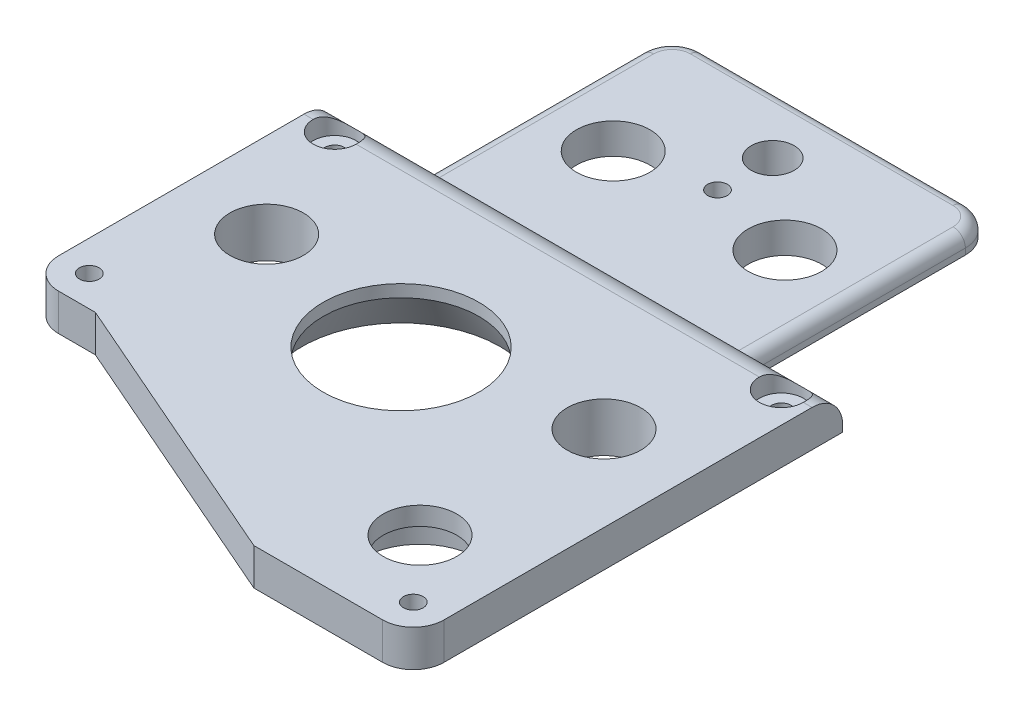
from build123d import *
from OCP.BRepFilletAPI import BRepFilletAPI_MakeChamfer

# Parameters (mm, degrees)
BOSS_EXTRUDE1_DEPTH = 3
BOSS_EXTRUDE2_DEPTH = 2
CHAMFER1_SIZE       = 2
CHAMFER1_SIZE_2     = 0.352653961
SKETCH3_R           = 6
SKETCH3_R_2         = 3.5
SKETCH3_R_3         = 1.6
CUT_EXTRUDE1_DEPTH  = 70.029171396
BOSS_EXTRUDE3_DEPTH = 3
FILLET1_R           = 5
CUT_EXTRUDE3_REACH  = 71.311
SKETCH6_R           = 12.7
SKETCH6_R_2         = 6
SKETCH7_R           = 9.5
CUT_EXTRUDE4_DEPTH  = 5
CHAMFER2_SIZE       = 6
CHAMFER2_SIZE2      = 3.464101615
FILLET2_R           = 5
FILLET3_R           = 2
SKETCH9_R           = 1.6
CUT_EXTRUDE5_DEPTH  = 70.311085058
SKETCH10_R          = 3.5
SKETCH10_R_2        = 3.584283701
CUT_EXTRUDE6_DEPTH  = 3
SKETCH11_W          = 5.4
SKETCH11_H          = 5.4
CUT_EXTRUDE7_DEPTH  = 2


# Some blends are built 0.0001 mm under size
with BuildPart() as part:
    # Sketch1 → Boss-Extrude1 (new body)
    with BuildSketch(Plane(origin=(0, 0, 0), x_dir=(1, 0, 0), z_dir=(0, 1, 0))):
        Polygon((-26.412878475, 15), (-26.412878475, 55), (26.412878475, 55), (26.412878475, 15), (41.412878475, 15), (41.412878475, -55), (15.412878475, -55), (-30.412878475, -35), (-41.412878475, -35), (-41.412878475, 15), align=None)
    extrude(amount=BOSS_EXTRUDE1_DEPTH)

    # Sketch2 → Boss-Extrude2 (add)
    with BuildSketch(Plane.XZ):
        Polygon((-38.162878475, 31.75), (-38.162878475, -11.75), (-23.162878475, -11.75), (-23.162878475, -51.75), (23.162878475, -51.75), (23.162878475, -11.75), (38.162878475, -11.75), (38.162878475, 51.75), (16.09119297, 51.75), (-29.734563979, 31.75), align=None)
    extrude(amount=BOSS_EXTRUDE2_DEPTH)

    # Chamfer1
    chamfer1_edges_1 = [part.edges().sort_by_distance(p)[0] for p in [
        (-33.948721227, -2, 31.75),
    ]]
    chamfer1_side_1 = [part.faces().sort_by_distance(p)[0] for p in [
        (-33.948721227, -1.992946921, 31.75),
    ]]
    chamfer1_edges_2 = [part.edges().sort_by_distance(p)[0] for p in [
        (-6.821685504, -2, 41.75),
    ]]
    chamfer1_side_2 = [part.faces().sort_by_distance(p)[0] for p in [
        (-6.821685504, -1.992946921, 41.75),
    ]]
    chamfer1_edges_3 = [part.edges().sort_by_distance(p)[0] for p in [
        (27.127035723, -2, 51.75),
    ]]
    chamfer1_side_3 = [part.faces().sort_by_distance(p)[0] for p in [
        (27.127035723, -1.992946921, 51.75),
    ]]
    chamfer1_edges_4 = [part.edges().sort_by_distance(p)[0] for p in [
        (38.162878475, -2, 20),
    ]]
    chamfer1_side_4 = [part.faces().sort_by_distance(p)[0] for p in [
        (38.162878475, -1.992946921, 20),
    ]]
    chamfer1_edges_5 = [part.edges().sort_by_distance(p)[0] for p in [
        (30.662878475, -2, -11.75),
    ]]
    chamfer1_side_5 = [part.faces().sort_by_distance(p)[0] for p in [
        (30.662878475, -1.992946921, -11.75),
    ]]
    chamfer1_edges_6 = [part.edges().sort_by_distance(p)[0] for p in [
        (23.162878475, -2, -31.75),
    ]]
    chamfer1_side_6 = [part.faces().sort_by_distance(p)[0] for p in [
        (23.162878475, -1.992946921, -31.75),
    ]]
    chamfer1_edges_7 = [part.edges().sort_by_distance(p)[0] for p in [
        (0, -2, -51.75),
    ]]
    chamfer1_side_7 = [part.faces().sort_by_distance(p)[0] for p in [
        (0, -1.992946921, -51.75),
    ]]
    chamfer1_edges_8 = [part.edges().sort_by_distance(p)[0] for p in [
        (-23.162878475, -2, -31.75),
    ]]
    chamfer1_side_8 = [part.faces().sort_by_distance(p)[0] for p in [
        (-23.162878475, -1.992946921, -31.75),
    ]]
    chamfer1_edges_9 = [part.edges().sort_by_distance(p)[0] for p in [
        (-30.662878475, -2, -11.75),
    ]]
    chamfer1_side_9 = [part.faces().sort_by_distance(p)[0] for p in [
        (-30.662878475, -1.992946921, -11.75),
    ]]
    chamfer1_edges_10 = [part.edges().sort_by_distance(p)[0] for p in [
        (-38.162878475, -2, 10),
    ]]
    chamfer1_side_10 = [part.faces().sort_by_distance(p)[0] for p in [
        (-38.162878475, -1.992946921, 10),
    ]]
    chamfer1 = BRepFilletAPI_MakeChamfer(part.part.solid().wrapped)
    for e in chamfer1_edges_1:
        chamfer1.Add(CHAMFER1_SIZE - 0.0001, CHAMFER1_SIZE_2 - 0.0001, e.wrapped, chamfer1_side_1[0].wrapped)
    for e in chamfer1_edges_2:
        chamfer1.Add(CHAMFER1_SIZE - 0.0001, CHAMFER1_SIZE_2 - 0.0001, e.wrapped, chamfer1_side_2[0].wrapped)
    for e in chamfer1_edges_3:
        chamfer1.Add(CHAMFER1_SIZE - 0.0001, CHAMFER1_SIZE_2 - 0.0001, e.wrapped, chamfer1_side_3[0].wrapped)
    for e in chamfer1_edges_4:
        chamfer1.Add(CHAMFER1_SIZE - 0.0001, CHAMFER1_SIZE_2 - 0.0001, e.wrapped, chamfer1_side_4[0].wrapped)
    for e in chamfer1_edges_5:
        chamfer1.Add(CHAMFER1_SIZE - 0.0001, CHAMFER1_SIZE_2 - 0.0001, e.wrapped, chamfer1_side_5[0].wrapped)
    for e in chamfer1_edges_6:
        chamfer1.Add(CHAMFER1_SIZE - 0.0001, CHAMFER1_SIZE_2 - 0.0001, e.wrapped, chamfer1_side_6[0].wrapped)
    for e in chamfer1_edges_7:
        chamfer1.Add(CHAMFER1_SIZE - 0.0001, CHAMFER1_SIZE_2 - 0.0001, e.wrapped, chamfer1_side_7[0].wrapped)
    for e in chamfer1_edges_8:
        chamfer1.Add(CHAMFER1_SIZE - 0.0001, CHAMFER1_SIZE_2 - 0.0001, e.wrapped, chamfer1_side_8[0].wrapped)
    for e in chamfer1_edges_9:
        chamfer1.Add(CHAMFER1_SIZE - 0.0001, CHAMFER1_SIZE_2 - 0.0001, e.wrapped, chamfer1_side_9[0].wrapped)
    for e in chamfer1_edges_10:
        chamfer1.Add(CHAMFER1_SIZE - 0.0001, CHAMFER1_SIZE_2 - 0.0001, e.wrapped, chamfer1_side_10[0].wrapped)
    add(Compound.cast(chamfer1.Shape()), mode=Mode.REPLACE)  # a hair under: the kernel refuses the full size

    # Sketch3 → Cut-Extrude1 (cut, through all)
    with BuildSketch(Plane(origin=(0, 3, 0), x_dir=(1, 0, 0), z_dir=(0, 1, 0))):
        with Locations(Location((-14, 33, 0), (0, 0, 270))):
            Circle(SKETCH3_R)
        with Locations(Location((14, 33, 0), (0, 0, 270))):
            Circle(SKETCH3_R)
        with Locations(Location((0, 45, 0), (0, 0, 270))):
            Circle(SKETCH3_R_2)
        with Locations(Location((0, 36, 0), (0, 0, 270))):
            Circle(SKETCH3_R_3)
    extrude(amount=-CUT_EXTRUDE1_DEPTH, mode=Mode.SUBTRACT)

    # Sketch4 → Boss-Extrude3 (add)
    with BuildSketch(Plane(origin=(0, 3, 0), x_dir=(1, 0, 0), z_dir=(0, 1, 0))):
        Polygon((-41.412878475, 15), (41.412878475, 15), (41.412878475, -55), (15.412878475, -55), (-30.412878475, -35), (-41.412878475, -35), align=None)
    extrude(amount=BOSS_EXTRUDE3_DEPTH)

    # Fillet1
    # the kernel refuses this fillet: 5 mm, written as the material it takes off along each edge
    with BuildSketch(Plane(origin=(-53.912878475, 6, -15), x_dir=(0, -1, 0), z_dir=(1, 0, 0))) as fillet1_piece_1_section:
        with BuildLine():
            CenterArc((FILLET1_R, -FILLET1_R), FILLET1_R, 90, 90)
            Line((0, -FILLET1_R), (0, 0))
            Line((0, 0), (FILLET1_R, 0))
        make_face()
    fillet1_piece_1 = extrude(amount=107.82575695, mode=Mode.PRIVATE)
    fillet1_piece_1 = split(fillet1_piece_1, bisect_by=Plane(origin=(-40.162878475, 3, -14.94934076), z_dir=(0, -1, 0)), keep=Keep.TOP, mode=Mode.PRIVATE)
    fillet1_piece_1 = split(fillet1_piece_1, bisect_by=Plane(origin=(-26.412878475, 2.291256669, -14.94934076), z_dir=(-1, 0, 0)), keep=Keep.TOP, mode=Mode.PRIVATE)
    add(fillet1_piece_1, mode=Mode.SUBTRACT)
    with BuildSketch(Plane(origin=(-53.912878475, 6, -15), x_dir=(0, -1, 0), z_dir=(1, 0, 0))) as fillet1_piece_2_section:
        with BuildLine():
            CenterArc((FILLET1_R, -FILLET1_R), FILLET1_R, 90, 90)
            Line((0, -FILLET1_R), (0, 0))
            Line((0, 0), (FILLET1_R, 0))
        make_face()
    fillet1_piece_2 = extrude(amount=107.82575695, mode=Mode.PRIVATE)
    fillet1_piece_2 = split(fillet1_piece_2, bisect_by=Plane(origin=(-40.162878475, 3, -13.781274122), z_dir=(0, 1, 0)), keep=Keep.TOP, mode=Mode.PRIVATE)
    fillet1_piece_2 = split(fillet1_piece_2, bisect_by=Plane(origin=(-26.412878475, 5.074749682, -13.781274122), z_dir=(-1, 0, 0)), keep=Keep.TOP, mode=Mode.PRIVATE)
    add(fillet1_piece_2, mode=Mode.SUBTRACT)
    with BuildSketch(Plane(origin=(-53.912878475, 6, -15), x_dir=(0, -1, 0), z_dir=(1, 0, 0))) as fillet1_piece_3_section:
        with BuildLine():
            CenterArc((FILLET1_R, -FILLET1_R), FILLET1_R, 90, 90)
            Line((0, -FILLET1_R), (0, 0))
            Line((0, 0), (FILLET1_R, 0))
        make_face()
    fillet1_piece_3 = extrude(amount=107.82575695, mode=Mode.PRIVATE)
    fillet1_piece_3 = split(fillet1_piece_3, bisect_by=Plane(origin=(0, 3, -13.781274122), z_dir=(0, 1, 0)), keep=Keep.TOP, mode=Mode.PRIVATE)
    fillet1_piece_3 = split(fillet1_piece_3, bisect_by=Plane(origin=(-26.412878475, 5.074749682, -13.781274122), z_dir=(1, 0, 0)), keep=Keep.TOP, mode=Mode.PRIVATE)
    fillet1_piece_3 = split(fillet1_piece_3, bisect_by=Plane(origin=(26.412878475, 5.074749682, -13.781274122), z_dir=(-1, 0, 0)), keep=Keep.TOP, mode=Mode.PRIVATE)
    add(fillet1_piece_3, mode=Mode.SUBTRACT)
    with BuildSketch(Plane(origin=(-53.912878475, 6, -15), x_dir=(0, -1, 0), z_dir=(1, 0, 0))) as fillet1_piece_4_section:
        with BuildLine():
            CenterArc((FILLET1_R, -FILLET1_R), FILLET1_R, 90, 90)
            Line((0, -FILLET1_R), (0, 0))
            Line((0, 0), (FILLET1_R, 0))
        make_face()
    fillet1_piece_4 = extrude(amount=107.82575695, mode=Mode.PRIVATE)
    fillet1_piece_4 = split(fillet1_piece_4, bisect_by=Plane(origin=(40.162878475, 3, -14.94934076), z_dir=(0, -1, 0)), keep=Keep.TOP, mode=Mode.PRIVATE)
    fillet1_piece_4 = split(fillet1_piece_4, bisect_by=Plane(origin=(26.412878475, 2.291256669, -14.94934076), z_dir=(1, 0, 0)), keep=Keep.TOP, mode=Mode.PRIVATE)
    add(fillet1_piece_4, mode=Mode.SUBTRACT)
    with BuildSketch(Plane(origin=(-53.912878475, 6, -15), x_dir=(0, -1, 0), z_dir=(1, 0, 0))) as fillet1_piece_5_section:
        with BuildLine():
            CenterArc((FILLET1_R, -FILLET1_R), FILLET1_R, 90, 90)
            Line((0, -FILLET1_R), (0, 0))
            Line((0, 0), (FILLET1_R, 0))
        make_face()
    fillet1_piece_5 = extrude(amount=107.82575695, mode=Mode.PRIVATE)
    fillet1_piece_5 = split(fillet1_piece_5, bisect_by=Plane(origin=(40.162878475, 3, -13.781274122), z_dir=(0, 1, 0)), keep=Keep.TOP, mode=Mode.PRIVATE)
    fillet1_piece_5 = split(fillet1_piece_5, bisect_by=Plane(origin=(26.412878475, 5.074749682, -13.781274122), z_dir=(1, 0, 0)), keep=Keep.TOP, mode=Mode.PRIVATE)
    add(fillet1_piece_5, mode=Mode.SUBTRACT)

    # Sketch6 → Cut-Extrude3 (cut, up to next)
    with BuildSketch(Plane(origin=(0, 6, 0), x_dir=(1, 0, 0), z_dir=(0, 1, 0)), mode=Mode.PRIVATE) as cut_extrude3_sk1:
        with Locations(Location((-0.587121525, -15, 0), (0, 0, 270))):
            Circle(SKETCH6_R)
    cut_extrude3_tool1 = extrude(cut_extrude3_sk1.sketch, amount=-CUT_EXTRUDE3_REACH, mode=Mode.PRIVATE) & part.part
    # Sketch6 → Cut-Extrude3 (cut, up to next)
    with BuildSketch(Plane(origin=(0, 6, 0), x_dir=(1, 0, 0), z_dir=(0, 1, 0)), mode=Mode.PRIVATE) as cut_extrude3_sk2:
        with Locations(Location((-27.5, -10, 0), (0, 0, 270))):
            Circle(SKETCH6_R_2)
    cut_extrude3_tool2 = extrude(cut_extrude3_sk2.sketch, amount=-CUT_EXTRUDE3_REACH, mode=Mode.PRIVATE) & part.part
    # Sketch6 → Cut-Extrude3 (cut, up to next)
    with BuildSketch(Plane(origin=(0, 6, 0), x_dir=(1, 0, 0), z_dir=(0, 1, 0)), mode=Mode.PRIVATE) as cut_extrude3_sk3:
        with Locations(Location((27.5, -10, 0), (0, 0, 270))):
            Circle(SKETCH6_R_2)
    cut_extrude3_tool3 = extrude(cut_extrude3_sk3.sketch, amount=-CUT_EXTRUDE3_REACH, mode=Mode.PRIVATE) & part.part
    # Sketch6 → Cut-Extrude3 (cut, up to next)
    with BuildSketch(Plane(origin=(0, 6, 0), x_dir=(1, 0, 0), z_dir=(0, 1, 0)), mode=Mode.PRIVATE) as cut_extrude3_sk4:
        with Locations(Location((27.5, -40, 0), (0, 0, 270))):
            Circle(SKETCH6_R_2)
    cut_extrude3_tool4 = extrude(cut_extrude3_sk4.sketch, amount=-CUT_EXTRUDE3_REACH, mode=Mode.PRIVATE) & part.part
    add(cut_extrude3_tool1.solids().sort_by_distance((-0.587122, 6, 15))[0], mode=Mode.SUBTRACT)
    add(cut_extrude3_tool2.solids().sort_by_distance((-27.5, 6, 10))[0], mode=Mode.SUBTRACT)
    add(cut_extrude3_tool3.solids().sort_by_distance((27.5, 6, 10))[0], mode=Mode.SUBTRACT)
    add(cut_extrude3_tool4.solids().sort_by_distance((27.5, 6, 40))[0], mode=Mode.SUBTRACT)

    # Sketch7 → Cut-Extrude4 (cut)
    with BuildSketch(Plane.XZ.offset(2)):
        with Locations(Location((27.5, 40, 0), (0, 0, 270))):
            Circle(SKETCH7_R)
    extrude(amount=-CUT_EXTRUDE4_DEPTH, mode=Mode.SUBTRACT)

    # Chamfer2
    chamfer2_edges = [part.edges().sort_by_distance(p)[0] for p in [
        (-0.587121525, -2, 2.3),
    ]]
    chamfer2_side = [part.faces().sort_by_distance(p)[0] for p in [
        (-0.587121525, 2, 2.3),
    ]]
    chamfer(chamfer2_edges, length=CHAMFER2_SIZE, length2=CHAMFER2_SIZE2, reference=chamfer2_side[0])

    # Fillet2
    fillet2_edges = [part.edges().sort_by_distance(p)[0] for p in [
        (-26.412878475, 1.5, -55),
        (26.412878475, 1.5, -55),
        (41.412878475, 3, 55),
        (-41.412878475, 3, 35),
    ]]
    fillet(fillet2_edges, radius=FILLET2_R)

    # Fillet3
    fillet3_edges = [part.edges().sort_by_distance(p)[0] for p in [
        (26.412878475, 3, -32.291287847),
        (24.948412381, 3, -53.535533906),
        (0, 3, -55),
        (-24.948412381, 3, -53.535533906),
        (-26.412878475, 3, -32.291287847),
    ]]
    fillet(fillet3_edges, radius=FILLET3_R)

    # Sketch9 → Cut-Extrude5 (cut, through all)
    with BuildSketch(Plane(origin=(0, 6, 0), x_dir=(1, 0, 0), z_dir=(0, 1, 0))):
        with Locations(Location((36.412878475, -50, 0), (0, 0, 270))):
            Circle(SKETCH9_R)
        with Locations(Location((-36.412878475, -30, 0), (0, 0, 270))):
            Circle(SKETCH9_R)
        with Locations(Location((36.412878475, 10, 0), (0, 0, 330.849269712))):
            Circle(SKETCH9_R)
        with Locations(Location((-36.412878475, 10, 0), (0, 0, 209.150730288))):
            Circle(SKETCH9_R)
    extrude(amount=-CUT_EXTRUDE5_DEPTH, mode=Mode.SUBTRACT)

    # Sketch10 → Cut-Extrude6 (cut)
    with BuildSketch(Plane(origin=(0, 6, 0), x_dir=(1, 0, 0), z_dir=(0, 1, 0))):
        with Locations(Location((-36.412878475, 10, 0), (0, 0, 270))):
            Circle(SKETCH10_R)
        with Locations(Location((36.412878475, 10, 0), (0, 0, 270))):
            Circle(SKETCH10_R_2)
    extrude(amount=-CUT_EXTRUDE6_DEPTH, mode=Mode.SUBTRACT)

    # Sketch11 → Cut-Extrude7 (cut)
    with BuildSketch(Plane.XZ.offset(2)):
        with Locations((-35.462878475, -9.05)):
            Rectangle(SKETCH11_W, SKETCH11_H)
        with Locations((-35.462878475, 29.05)):
            Rectangle(SKETCH11_W, SKETCH11_H)
        with Locations((-20.462878475, -49.05)):
            Rectangle(SKETCH11_W, SKETCH11_H)
        with Locations((20.462878475, -49.05)):
            Rectangle(SKETCH11_W, SKETCH11_H)
        with Locations((35.462878475, -9.05)):
            Rectangle(SKETCH11_W, SKETCH11_H)
        with Locations((35.462878475, 49.05)):
            Rectangle(SKETCH11_W, SKETCH11_H)
    extrude(amount=-CUT_EXTRUDE7_DEPTH, mode=Mode.SUBTRACT)


solid = part.part
